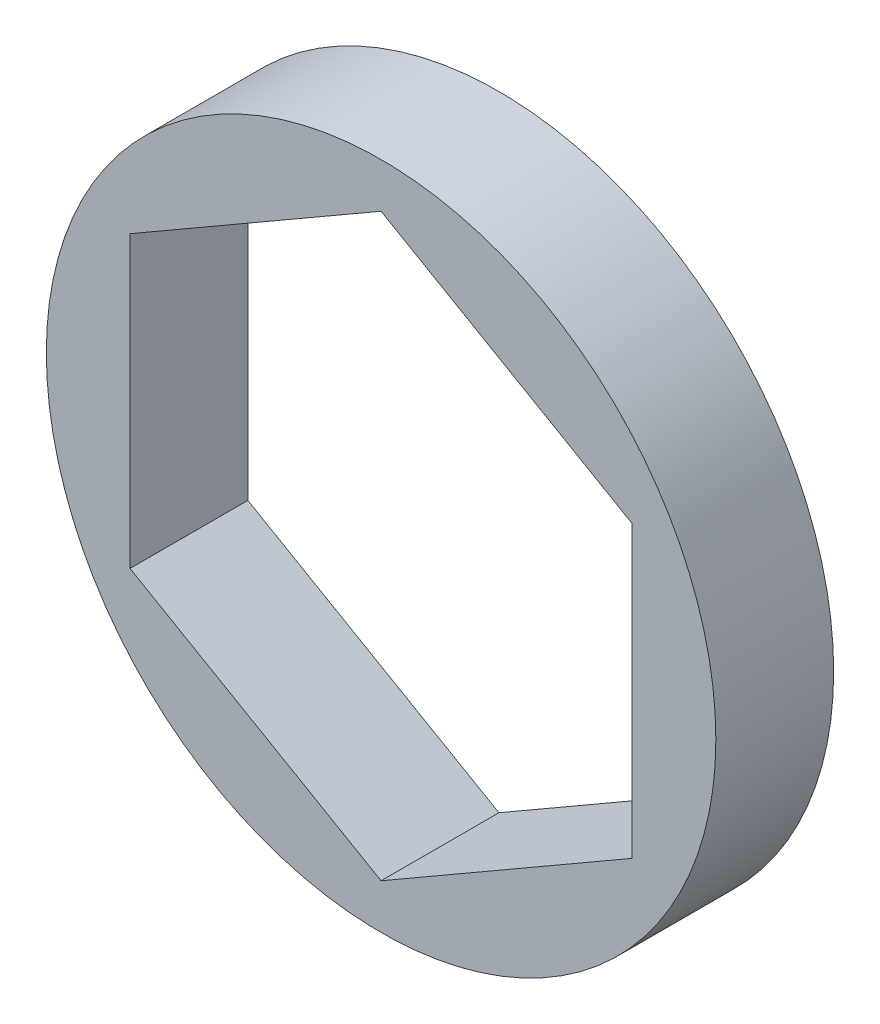
from build123d import *

# Parameters (mm, degrees)
SKETCH1_R           = 6.35
BOSS_EXTRUDE1_DEPTH = 2.2352


with BuildPart() as part:
    # Sketch1 → Boss-Extrude1 (new body)
    with BuildSketch(Plane.XY):
        Circle(SKETCH1_R)
        Polygon((0, 5.499261314), (-4.7625, 2.749630657), (-4.7625, -2.749630657), (0, -5.499261314), (4.7625, -2.749630657), (4.7625, 2.749630657), align=None, mode=Mode.SUBTRACT)
    extrude(amount=BOSS_EXTRUDE1_DEPTH)


solid = part.part
